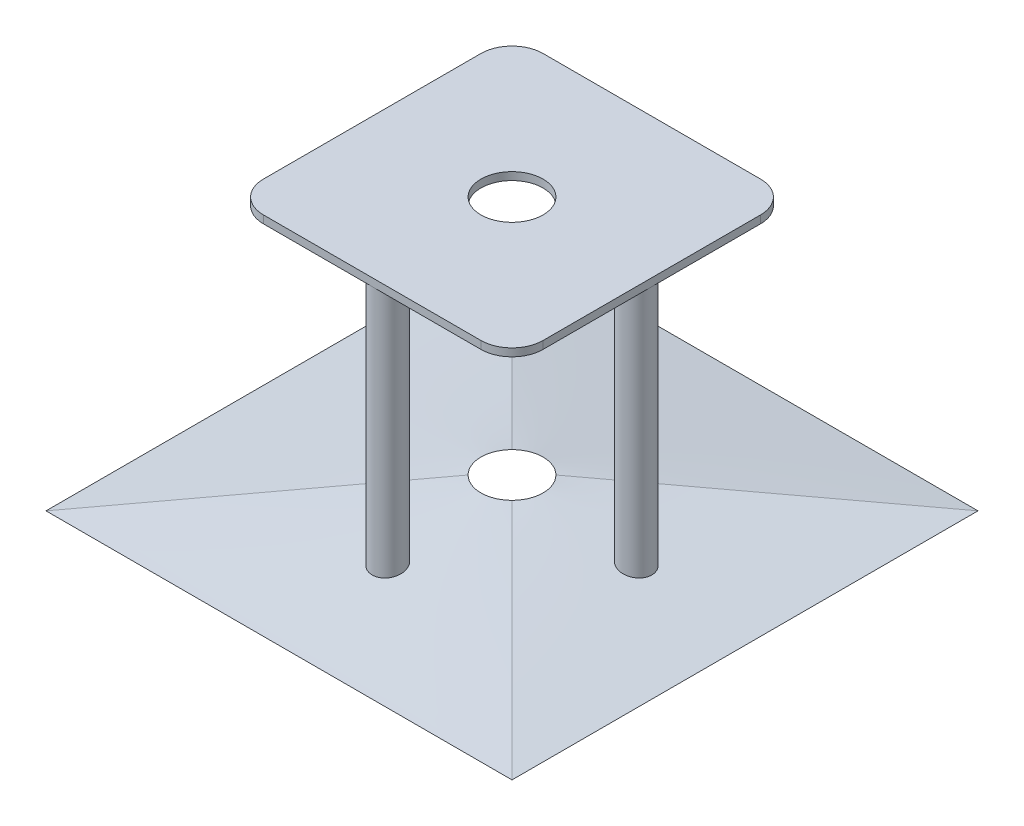
from build123d import *

# Parameters (mm, degrees)
CUT_EXTRUDE1_DEPTH      = 107.536378913
CUT_EXTRUDE1_DEPTH_BACK = 107.536378913
SKETCH3_R               = 10
SKETCH11_W              = 90
SKETCH11_H              = 90
BOSS_EXTRUDE1_DEPTH     = 2.5
BOSS_EXTRUDE2_REACH     = 142
BOSS_EXTRUDE2_START     = -2.5
SKETCH16_R              = 5
SKETCH3_2_R             = 10
CUT_EXTRUDE2_DEPTH      = 132.363046668
FILLET1_R               = 10


with BuildPart() as part:
    # Sketch1 → Loft1 section 0
    with BuildSketch(Plane(origin=(0, 0, 0), x_dir=(1, 0, 0), z_dir=(0, 1, 0))):
        with BuildLine():
            Line((75, -75), (-75, -75))
            Line((-75, -75), (-75, 75))
            Line((-75, 75), (75, 75))
            Line((75, 75), (75, -75))
        make_face()
    # Sketch2 for Loft1 → Loft1 section 1
    with BuildSketch(Plane(origin=(0, 10, 0), x_dir=(1, 0, 0), z_dir=(0, 1, 0))):
        with BuildLine():
            # circular arc as an exact rational Bezier (weights 1, cos(half-angle), 1)
            Bezier((7.071067812, -7.071067812), (0, -14.142135623), (-7.071067812, -7.071067812), weights=[1, 0.707106781, 1])
            Bezier((-7.071067812, -7.071067812), (-14.142135623, 0), (-7.071067812, 7.071067812), weights=[1, 0.707106781, 1])
            Bezier((-7.071067812, 7.071067812), (0, 14.142135623), (7.071067812, 7.071067812), weights=[1, 0.707106781, 1])
            Bezier((7.071067812, 7.071067812), (14.142135623, 0), (7.071067812, -7.071067812), weights=[1, 0.707106781, 1])
        make_face()
    loft()

    # Sketch3 → Cut-Extrude1 (cut, two sides: drawn at the far end of the back side and taken through both)
    with BuildSketch(Plane(origin=(0, 10, 0), x_dir=(1, 0, 0), z_dir=(0, 1, 0)).offset(-CUT_EXTRUDE1_DEPTH_BACK)):
        Circle(SKETCH3_R)
    extrude(amount=CUT_EXTRUDE1_DEPTH + CUT_EXTRUDE1_DEPTH_BACK, mode=Mode.SUBTRACT)

    # Sketch4 → Cut-Loft2 section 0
    with BuildSketch(Plane(origin=(0, 0, 0), x_dir=(1, 0, 0), z_dir=(0, 1, 0))):
        with BuildLine():
            Line((-72.5, -72.5), (72.5, -72.5))
            Line((72.5, -72.5), (72.5, 72.5))
            Line((72.5, 72.5), (-72.5, 72.5))
            Line((-72.5, 72.5), (-72.5, -72.5))
        make_face()
    # Sketch2<5> for Cut-Loft2 → Cut-Loft2 section 1
    with BuildSketch(Plane(origin=(0, 10, 0), x_dir=(1, 0, 0), z_dir=(0, 1, 0))):
        with BuildLine():
            Bezier((-7.071067812, -7.071067812), (0, -14.142135623), (7.071067812, -7.071067812), weights=[1, 0.707106781, 1])
            Bezier((7.071067812, -7.071067812), (14.142135623, 0), (7.071067812, 7.071067812), weights=[1, 0.707106781, 1])
            Bezier((7.071067812, 7.071067812), (0, 14.142135623), (-7.071067812, 7.071067812), weights=[1, 0.707106781, 1])
            Bezier((-7.071067812, 7.071067812), (-14.142135623, 0), (-7.071067812, -7.071067812), weights=[1, 0.707106781, 1])
        make_face()
    loft(mode=Mode.SUBTRACT)

    # Sketch16 → Boss-Extrude2 (add, up to next)
    with BuildSketch(Plane(origin=(0, 87.5, 0), x_dir=(1, 0, 0), z_dir=(0, 1, 0)).offset(BOSS_EXTRUDE2_START), mode=Mode.PRIVATE) as boss_extrude2_sk1:
        with Locations((0, 40)):
            Circle(SKETCH16_R)
    boss_extrude2_tool1 = extrude(boss_extrude2_sk1.sketch, amount=-BOSS_EXTRUDE2_REACH, mode=Mode.PRIVATE) - part.part
    # Sketch16 → Boss-Extrude2 (add, up to next)
    with BuildSketch(Plane(origin=(0, 87.5, 0), x_dir=(1, 0, 0), z_dir=(0, 1, 0)).offset(BOSS_EXTRUDE2_START), mode=Mode.PRIVATE) as boss_extrude2_sk2:
        with Locations((-40, 0)):
            Circle(SKETCH16_R)
    boss_extrude2_tool2 = extrude(boss_extrude2_sk2.sketch, amount=-BOSS_EXTRUDE2_REACH, mode=Mode.PRIVATE) - part.part
    # Sketch16 → Boss-Extrude2 (add, up to next)
    with BuildSketch(Plane(origin=(0, 87.5, 0), x_dir=(1, 0, 0), z_dir=(0, 1, 0)).offset(BOSS_EXTRUDE2_START), mode=Mode.PRIVATE) as boss_extrude2_sk3:
        with Locations((0, -40)):
            Circle(SKETCH16_R)
    boss_extrude2_tool3 = extrude(boss_extrude2_sk3.sketch, amount=-BOSS_EXTRUDE2_REACH, mode=Mode.PRIVATE) - part.part
    # Sketch16 → Boss-Extrude2 (add, up to next)
    with BuildSketch(Plane(origin=(0, 87.5, 0), x_dir=(1, 0, 0), z_dir=(0, 1, 0)).offset(BOSS_EXTRUDE2_START), mode=Mode.PRIVATE) as boss_extrude2_sk4:
        with Locations((40, 0)):
            Circle(SKETCH16_R)
    boss_extrude2_tool4 = extrude(boss_extrude2_sk4.sketch, amount=-BOSS_EXTRUDE2_REACH, mode=Mode.PRIVATE) - part.part


with BuildPart() as body_2:
    # Sketch11 → Boss-Extrude1 (new body)
    with BuildSketch(Plane(origin=(0, 85, 0), x_dir=(-1, 0, 0), z_dir=(0, -1, 0))):
        Rectangle(SKETCH11_W, SKETCH11_H)
    extrude(amount=-BOSS_EXTRUDE1_DEPTH)


with BuildPart() as part_1:
    add(part.part)

    add(body_2.part)  # Boss-Extrude2 merges body 2
    add(boss_extrude2_tool1.solids().sort_by_distance((0, 85, -40))[0])
    add(boss_extrude2_tool2.solids().sort_by_distance((-40, 85, 0))[0])
    add(boss_extrude2_tool3.solids().sort_by_distance((0, 85, 40))[0])
    add(boss_extrude2_tool4.solids().sort_by_distance((40, 85, 0))[0])

    # Sketch3<2> → Cut-Extrude2 (cut, through all)
    with BuildSketch(Plane(origin=(0, 10, 0), x_dir=(1, 0, 0), z_dir=(0, 1, 0))):
        Circle(SKETCH3_2_R)
    extrude(amount=CUT_EXTRUDE2_DEPTH, mode=Mode.SUBTRACT)

    # Fillet1
    fillet1_edges = [part_1.edges().sort_by_distance(p)[0] for p in [
        (-45, 86.25, -45),
        (-45, 86.25, 45),
        (45, 86.25, 45),
        (45, 86.25, -45),
    ]]
    fillet(fillet1_edges, radius=FILLET1_R)


solid = part_1.part
